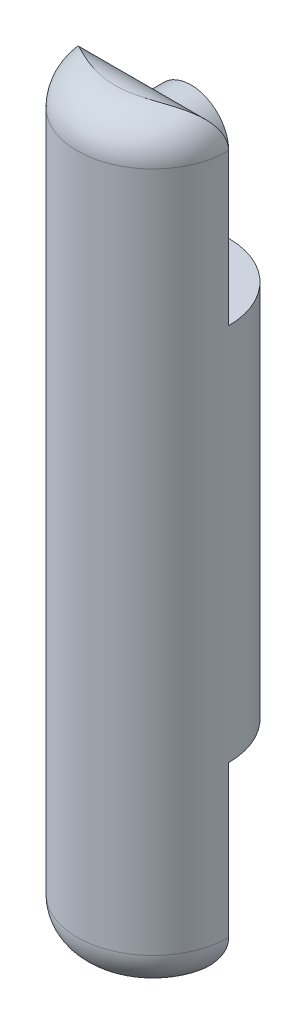
from build123d import *

# Parameters (mm, degrees)
SKETCH1_R           = 10
BOSS_EXTRUDE1_DEPTH = 100
SKETCH4_W           = 20
SKETCH4_H           = 25
CUT_EXTRUDE2_DEPTH  = 10
SKETCH7_R           = 5
BOSS_EXTRUDE2_DEPTH = 5
FILLET7_R           = 5
SKETCH9_R           = 5
CUT_EXTRUDE3_DEPTH  = 5
FILLET8_R           = 5


with BuildPart() as part:
    # Sketch1 → Boss-Extrude1 (new body)
    with BuildSketch(Plane(origin=(0, 0, 0), x_dir=(1, 0, 0), z_dir=(0, 1, 0))):
        with Locations(Location((0, 0, 0), (0, 0, 90))):
            Circle(SKETCH1_R)
    extrude(amount=BOSS_EXTRUDE1_DEPTH)

    # Sketch4 → Cut-Extrude2 (cut)
    with BuildSketch(Plane.XY):
        with Locations((0, 87.5)):
            Rectangle(SKETCH4_W, SKETCH4_H)
    cut_extrude2 = extrude(amount=-CUT_EXTRUDE2_DEPTH, mode=Mode.SUBTRACT)

    # Sketch7 → Boss-Extrude2 (add)
    with BuildSketch(Plane.XY):
        with Locations((0, 90.066469536)):
            Circle(SKETCH7_R)
        with Locations((0, 9.933530464)):
            Circle(SKETCH7_R)
    extrude(amount=-BOSS_EXTRUDE2_DEPTH)

    # Fillet7
    # the kernel refuses this fillet: 5 mm, written as the material it takes off along each edge
    with BuildSketch(Plane(origin=(-22.5, 100, 0), x_dir=(0, -1, 0), z_dir=(1, 0, 0))) as fillet7_piece_1_section:
        with BuildLine():
            CenterArc((FILLET7_R, -FILLET7_R), FILLET7_R, 90, 90)
            Line((0, -FILLET7_R), (0, 0))
            Line((0, 0), (FILLET7_R, 0))
        make_face()
    fillet7_piece_1 = extrude(amount=45, mode=Mode.PRIVATE)
    fillet7_piece_1 = fillet7_piece_1 - Plane(origin=(0, 90.066469536, 1.132005312), x_dir=(1, 0, 0), z_dir=(0, 0, 1)) * Cylinder(5, 110, mode=Mode.PRIVATE)
    add(fillet7_piece_1, mode=Mode.SUBTRACT)
    with BuildSketch(Plane(origin=(0, 100, 0), x_dir=(-0.3134140431814407, 0, -0.9496165739584909), z_dir=(0.9496165739584909, 0, -0.3134140431814407))) as fillet7_piece_2:
        with BuildLine():
            CenterArc((10 - FILLET7_R, -FILLET7_R), FILLET7_R, 0, 90)
            Line((10 - FILLET7_R, 0), (10, 0))
            Line((10, 0), (10, -FILLET7_R))
        make_face()
    revolve(axis=Axis((0, 100, 0), (0, 1, 0)), revolution_arc=323.469804901, mode=Mode.SUBTRACT)

    # Mirror3: Cut-Extrude2 across plane
    add(cut_extrude2.mirror(Plane.ZX.offset(50)), mode=Mode.SUBTRACT)

    # Sketch9 → Cut-Extrude3 (cut)
    with BuildSketch(Plane.XY):
        with Locations((0, 9.933530464)):
            Circle(SKETCH9_R)
    extrude(amount=CUT_EXTRUDE3_DEPTH, mode=Mode.SUBTRACT)

    # Fillet8
    # the kernel refuses this fillet: 5 mm, written as the material it takes off along each edge
    with BuildSketch(Plane(origin=(0, 0, 0), x_dir=(-0.31341404318144095, 0, -0.9496165739584909), z_dir=(0.9496165739584909, 0, -0.31341404318144095))) as fillet8_piece_1:
        with BuildLine():
            CenterArc((10 - FILLET8_R, FILLET8_R), FILLET8_R, 270, 90)
            Line((10 - FILLET8_R, 0), (10, 0))
            Line((10, 0), (10, FILLET8_R))
        make_face()
    revolve(axis=Axis((0, 0, 0), (0, 1, 0)), revolution_arc=323.469804901, mode=Mode.SUBTRACT)
    with BuildSketch(Plane(origin=(-22.5, 0, 0), x_dir=(0, 0, 1), z_dir=(1, 0, 0))) as fillet8_piece_2:
        with BuildLine():
            CenterArc((FILLET8_R, -FILLET8_R), FILLET8_R, 90, 90)
            Line((0, -FILLET8_R), (0, 0))
            Line((0, 0), (FILLET8_R, 0))
        make_face()
    extrude(amount=45, mode=Mode.SUBTRACT)


solid = part.part
